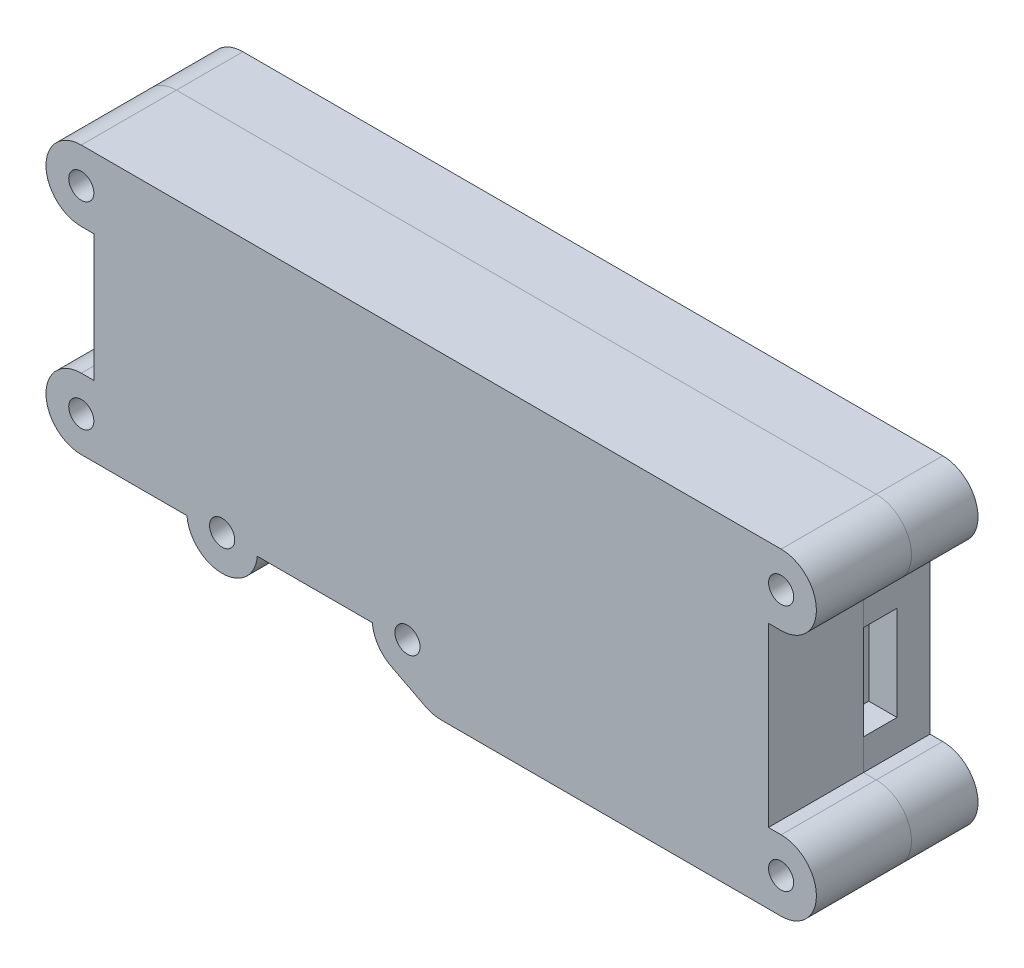
from build123d import *

# Parameters (mm, degrees)
BOSS_EXTRUDE6_START                               = 1.778
BOSS_EXTRUDE6_DEPTH                               = 11.39
SKETCH2_W                                         = 3.016
SKETCH2_H                                         = 8.516
CUT_EXTRUDE1_DEPTH                                = 2.54
SKETCH3_W                                         = 13.378
SKETCH3_H                                         = 5.778
SKETCH3_W_2                                       = 5.516
SKETCH3_H_2                                       = 3.016
BOSS_EXTRUDE2_DEPTH                               = 0.508
BOSS_EXTRUDE2_DIRECTION_2_REACH                   = 49.132
BOSS_EXTRUDE4_DEPTH                               = 3.154
SKETCH6_R                                         = 3.175
BOSS_EXTRUDE3_DEPTH                               = 14.544
BOSS_EXTRUDE7_DEPTH                               = 14.544
CSK_FOR_4_FLAT_HEAD_MACHINE_SCREW_100_D           = 3.2639
CSK_FOR_4_FLAT_HEAD_MACHINE_SCREW_100_DEPTH       = 5.985
CSK_FOR_4_FLAT_HEAD_MACHINE_SCREW_100_CSINK_D     = 5.715
CSK_FOR_4_FLAT_HEAD_MACHINE_SCREW_100_CSINK_ANGLE = 100
CSK_FOR_4_FLAT_HEAD_MACHINE_SCREW_100_TIP         = 0.980574487
TAP_DRILL_FOR_4_40_TAP1_D                         = 2.2606
FILLET1_R                                         = 3.175


# Read off the part's stored shape, not the designer's step: Split1
with BuildPart() as part:
    # Sketch16 → Boss-Extrude6 (new body)
    with BuildSketch(Plane(origin=(0, 0, -9.104), x_dir=(-1, 0, 0), z_dir=(0, 0, -1)).offset(BOSS_EXTRUDE6_START)):
        Polygon((-8.655999008, -16.934), (-8.655999008, -12.446), (21.844, -12.446), (21.844, -11.684), (21.844, 11.684), (-38.853999008, 11.684), (-38.853999008, -16.934), align=None)
    extrude(amount=-BOSS_EXTRUDE6_DEPTH)

    # Sketch2 → Cut-Extrude1 (cut)
    with BuildSketch(Plane(origin=(38.853999008, 0, 0), x_dir=(0, 0, -1), z_dir=(1, 0, 0))):
        with Locations((6.404, -3.54)):
            Rectangle(SKETCH2_W, SKETCH2_H)
    extrude(amount=-CUT_EXTRUDE1_DEPTH, mode=Mode.SUBTRACT)

    # Sketch3 → Boss-Extrude2 (add)
    with BuildSketch(Plane.XZ.offset(12.6746)):
        with Locations((-1.970000992, -6.388)):
            Rectangle(SKETCH3_W, SKETCH3_H)
        with Locations((-1.970000992, -6.388)):
            Rectangle(SKETCH3_W_2, SKETCH3_H_2, mode=Mode.SUBTRACT)
    extrude(amount=BOSS_EXTRUDE2_DEPTH)

    # Sketch3 → Boss-Extrude2 direction 2 (add, up to next)
    with BuildSketch(Plane.XZ.offset(12.6746), mode=Mode.PRIVATE) as boss_extrude2_direction_2_sk1:
        with Locations((-1.970000992, -6.388)):
            Rectangle(SKETCH3_W, SKETCH3_H)
        with Locations((-1.970000992, -6.388)):
            Rectangle(SKETCH3_W_2, SKETCH3_H_2, mode=Mode.SUBTRACT)
    boss_extrude2_direction_2_tool1 = extrude(boss_extrude2_direction_2_sk1.sketch, amount=-BOSS_EXTRUDE2_DIRECTION_2_REACH, mode=Mode.PRIVATE) - part.part
    add(boss_extrude2_direction_2_tool1.solids().sort_by_distance((-1.970001, -12.6746, -9.131276))[0])

    # Sketch14 → Boss-Extrude4 (add)
    with BuildSketch(Plane.XY.offset(0.508)):
        Polygon((-21.844, 11.684), (38.853999008, 11.684), (38.853999008, -16.934), (8.655999008, -16.934), (8.655999008, -12.446), (-21.844, -12.446), align=None)
    extrude(amount=BOSS_EXTRUDE4_DEPTH)

    # Sketch6 → Boss-Extrude3 (add, through all)
    with BuildSketch(Plane.XY.offset(3.662)):
        with Locations((-10.310000992, -12.192)):
            Circle(SKETCH6_R)
        with Locations((6.369999008, -12.192)):
            Circle(SKETCH6_R)
        with BuildLine():
            Line((-21.844, 11.684), (-22.987, 11.684))
            ThreePointArc((-22.987, 11.684), (-26.162, 8.509), (-22.987, 5.334))
            Line((-22.987, 5.334), (-21.844, 5.334))
            Line((-21.844, 5.334), (-21.844, 11.684))
        make_face()
        with BuildLine():
            Line((38.853999008, 5.334), (39.996999008, 5.334))
            ThreePointArc((39.996999008, 5.334), (43.171999008, 8.509), (39.996999008, 11.684))
            Line((39.996999008, 11.684), (38.853999008, 11.684))
            Line((38.853999008, 11.684), (38.853999008, 5.334))
        make_face()
        with BuildLine():
            Line((-21.844, -6.096), (-22.987, -6.096))
            ThreePointArc((-22.987, -6.096), (-26.162, -9.271), (-22.987, -12.446))
            Line((-22.987, -12.446), (-21.844, -12.446))
            Line((-21.844, -12.446), (-21.844, -6.096))
        make_face()
        with BuildLine():
            Line((38.853999008, -16.934), (39.996999008, -16.934))
            ThreePointArc((39.996999008, -16.934), (43.171999008, -13.759), (39.996999008, -10.584))
            Line((39.996999008, -10.584), (38.853999008, -10.584))
            Line((38.853999008, -10.584), (38.853999008, -16.934))
        make_face()
    extrude(amount=-BOSS_EXTRUDE3_DEPTH)

    # Sketch17 → Boss-Extrude7 (add)
    with BuildSketch(Plane(origin=(0, 0, 3.662), x_dir=(-1, 0, 0), z_dir=(0, 0, -1))):
        Polygon((-8.655999008, -16.934), (-4.920268793, -15.016695966), (-8.655999008, -14.39536765), align=None)
    extrude(amount=BOSS_EXTRUDE7_DEPTH)

    # CSK for #4 Flat Head Machine Screw (100)1
    with Locations(Plane(origin=(0, 0, -10.882), x_dir=(1, 0, 0), z_dir=(0, 0, -1))):
        with Locations((39.996999008, -8.509), (39.996999008, 13.759), (-22.987, 9.271), (-22.987, -8.509), (-10.310000992, 12.192), (6.369999008, 12.192)):
            CounterSinkHole(CSK_FOR_4_FLAT_HEAD_MACHINE_SCREW_100_D / 2, CSK_FOR_4_FLAT_HEAD_MACHINE_SCREW_100_CSINK_D / 2, depth=CSK_FOR_4_FLAT_HEAD_MACHINE_SCREW_100_DEPTH, counter_sink_angle=CSK_FOR_4_FLAT_HEAD_MACHINE_SCREW_100_CSINK_ANGLE)
            with Locations((0, 0, -(CSK_FOR_4_FLAT_HEAD_MACHINE_SCREW_100_DEPTH + CSK_FOR_4_FLAT_HEAD_MACHINE_SCREW_100_TIP / 2))):  # 118° drill point
                Cone(0, CSK_FOR_4_FLAT_HEAD_MACHINE_SCREW_100_D / 2, CSK_FOR_4_FLAT_HEAD_MACHINE_SCREW_100_TIP, mode=Mode.SUBTRACT)

    # Tap Drill for #4-40 Tap1 (through all)
    with Locations(Plane(origin=(0, 0, -10.882), x_dir=(1, 0, 0), z_dir=(0, 0, -1))):
        with Locations((39.996999008, -8.509), (39.996999008, 13.759), (-22.987, 9.271), (-22.987, -8.509), (-10.310000992, 12.192), (6.369999008, 12.192)):
            Hole(TAP_DRILL_FOR_4_40_TAP1_D / 2)

    # Fillet1
    fillet1_edges = [part.edges().sort_by_distance(p)[0] for p in [
        (8.655999008, -16.934, -3.61),
    ]]
    fillet(fillet1_edges, radius=FILLET1_R)


with BuildPart() as body_2:
    # Split1: the piece on the far side of the plane
    add(part.part)
    split(bisect_by=Plane.XY.offset(-4.896), keep=Keep.BOTTOM)


with BuildPart() as part_1:
    add(part.part)

    # Split1
    split(bisect_by=Plane.XY.offset(-4.896), keep=Keep.TOP)


solid = Compound([body_2.part, part_1.part])
